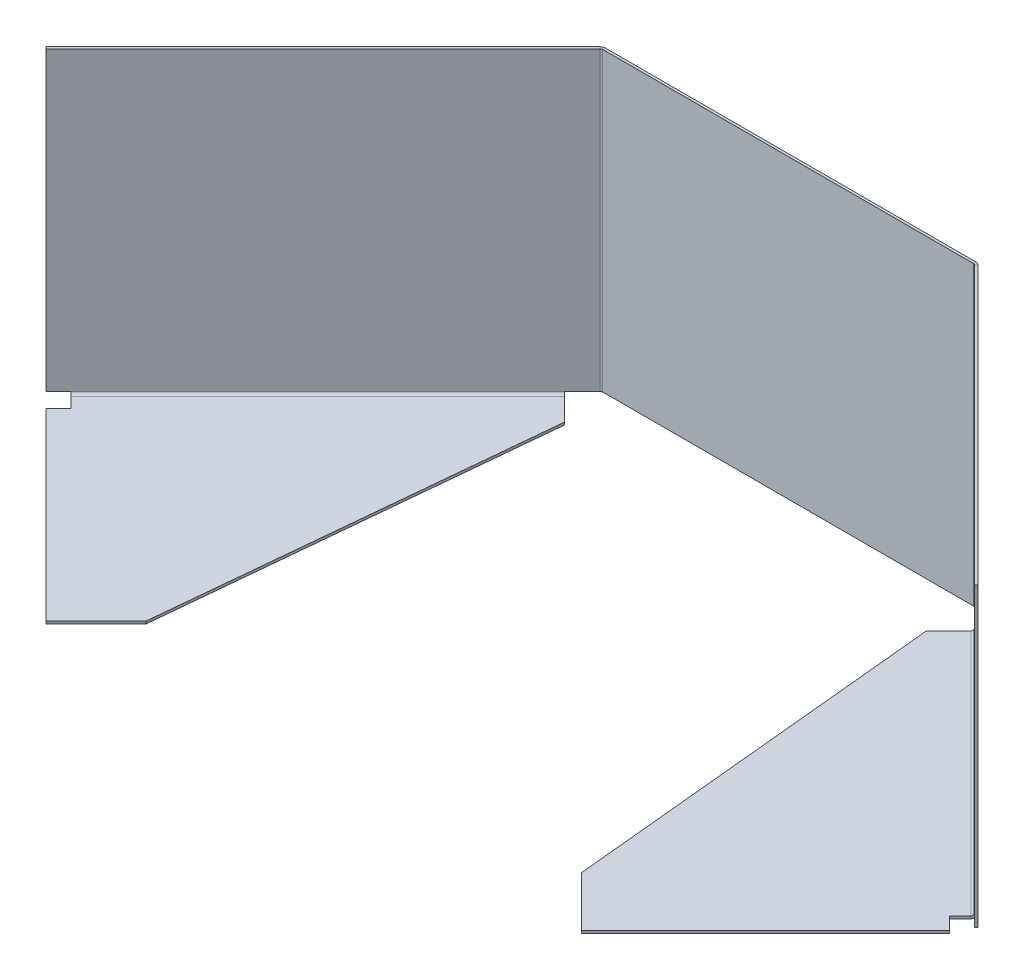
from build123d import *

# Parameters (mm, degrees)
SM_BASE_FLANGE_1_DEPTH      = 117.5
SM_EDGE_FLANGE_1_DEPTH      = 290.401572875
SM_START                    = 2
SM_EDGE_FLANGE_1_FLAT_DEPTH = 2
CUT_EXTRUDE_START           = -14
CUT_EXTRUDE_2_DEPTH         = 14


# Read off the part's stored shape, not the designer's step: 切除-拉伸2
# Sheet-metal steps are written as plain solids
with BuildPart() as part:
    # Sketch 1 → 基体-法兰1 (new, symmetric)
    with BuildSketch(Plane(origin=(0, 0, 0), x_dir=(1, 0, 0), z_dir=(0, 1, 0))):
        with BuildLine():
            Line((-367.697843509, -220.072843509), (-148.210786438, -0.585786438))
            ThreePointArc((-148.210786438, -0.585786438), (-147.56193974, -0.152240935), (-146.796572875, 0))
            Line((-146.796572875, 0), (146.796572875, 0))
            ThreePointArc((146.796572875, 0), (147.56193974, -0.152240935), (148.210786438, -0.585786438))
            Line((148.210786438, -0.585786438), (367.697843509, -220.072843509))
            Line((367.697843509, -220.072843509), (369.112057071, -218.658629946))
            Line((369.112057071, -218.658629946), (149.625, 0.828427125))
            ThreePointArc((149.625, 0.828427125), (148.327306605, 1.69551813), (146.796572875, 2))
            Line((146.796572875, 2), (-146.796572875, 2))
            ThreePointArc((-146.796572875, 2), (-148.327306605, 1.69551813), (-149.625, 0.828427125))
            Line((-149.625, 0.828427125), (-369.112057071, -218.658629946))
            Line((-369.112057071, -218.658629946), (-367.697843509, -220.072843509))
        make_face()
    extrude(amount=SM_BASE_FLANGE_1_DEPTH, both=True)

    # 边线-法兰1 bend section (across the edge) → 边线-法兰1 (add)
    with BuildSketch(Plane(origin=(162.352922061, -119.5, 14.727922061), x_dir=(0, 1, 0), z_dir=(0.7071067811865512, 0, 0.7071067811865439))):
        with BuildLine():
            Line((-2, 2), (0, 2))
            ThreePointArc((0, 2), (0.585786438, 0.585786438), (2, 0))
            Line((2, 0), (2, -2))
            ThreePointArc((2, -2), (-0.828427125, -0.828427125), (-2, 2))
        make_face()
    sm_edge_flange_1 = extrude(amount=SM_EDGE_FLANGE_1_DEPTH)

    # 边线-法兰1 profile (on flange) → 边线-法兰1 flat (add)
    with BuildSketch(Plane(origin=(73.8125, -119.5, -73.8125), x_dir=(0.7071067811865512, 0, 0.7071067811865439), z_dir=(0, -1, 0)).offset(SM_START)):
        Polygon((359.616638573, 220), (125.215065697, 27), (125.215065697, 2), (415.616638573, 2), (415.616638573, 220), align=None)
    sm_edge_flange_1_flat = extrude(amount=-SM_EDGE_FLANGE_1_FLAT_DEPTH)

    # 切除-拉伸2 outline → 切除-拉伸2 (cut)
    with BuildSketch(Plane(origin=(293.885343509, 0, 293.885343509), x_dir=(0.7071067811865338, 0, -0.7071067811865613), z_dir=(0.7071067811865613, 0, 0.7071067811865338)).offset(CUT_EXTRUDE_START)):
        with BuildLine():
            ThreePointArc((102.386638573, -121.5), (105.215065697, -120.328427125), (106.386638573, -117.5))
            Line((106.386638573, -117.5), (104.386638573, -117.5))
            ThreePointArc((104.386638573, -117.5), (103.800852135, -118.914213562), (102.386638573, -119.5))
            Line((102.386638573, -119.5), (90.386638573, -119.5))
            Line((90.386638573, -119.5), (90.386638573, -121.5))
            Line((90.386638573, -121.5), (102.386638573, -121.5))
        make_face()
    cut_extrude_2 = extrude(amount=CUT_EXTRUDE_2_DEPTH, mode=Mode.SUBTRACT)

    # 镜向1: 边线-法兰1, 边线-法兰1 flat, 切除-拉伸2 across plane
    add(sm_edge_flange_1.mirror(Plane(origin=(0, 0, 0), x_dir=(0, 0, 1), z_dir=(1, 0, 0))))
    add(sm_edge_flange_1_flat.mirror(Plane(origin=(0, 0, 0), x_dir=(0, 0, 1), z_dir=(1, 0, 0))))
    add(cut_extrude_2.mirror(Plane(origin=(0, 0, 0), x_dir=(0, 0, 1), z_dir=(1, 0, 0))), mode=Mode.SUBTRACT)


solid = part.part
